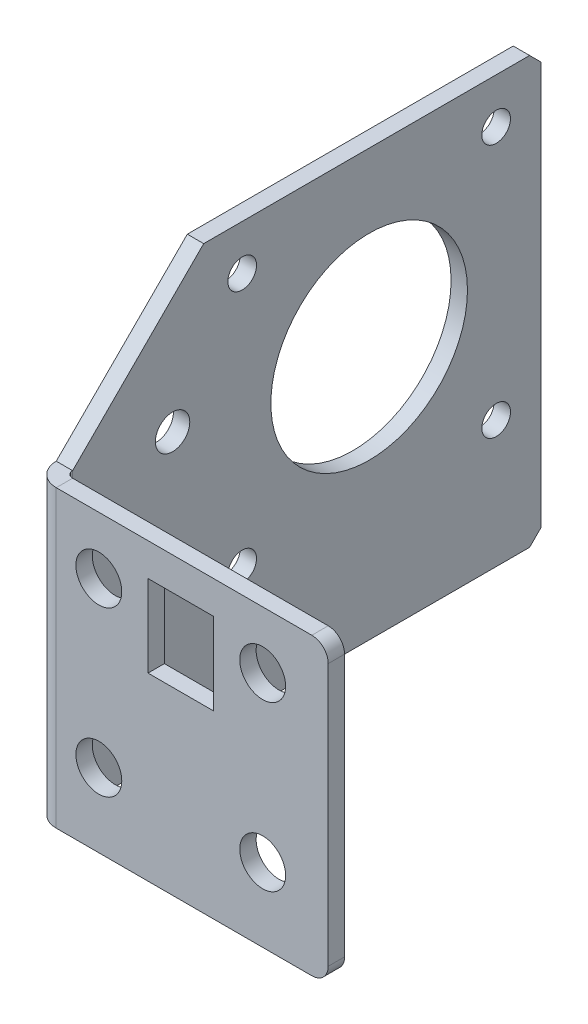
from build123d import *

# Parameters (mm, degrees)
BASE_FLANGE1_DEPTH = 52
CUT_EXTRUDE1_DEPTH = 88.177978871
FILLET1_R          = 2
SKETCH7_R          = 12
SKETCH7_R_2        = 1.75
CUT_EXTRUDE2_DEPTH = 10
SKETCH8_R          = 2.8
CUT_EXTRUDE3_DEPTH = 2
SKETCH9_W          = 8
SKETCH9_H          = 10
CUT_EXTRUDE4_DEPTH = 10
SKETCH10_R         = 2.1
CUT_EXTRUDE5_DEPTH = 10


# Sheet-metal steps are written as plain solids
with BuildPart() as part:
    # Sketch1 → Base-Flange1 (new body)
    with BuildSketch(Plane(origin=(0, 0, 0), x_dir=(1, 0, 0), z_dir=(0, 1, 0))):
        with BuildLine():
            Line((36, 0), (2.8, 0))
            ThreePointArc((2.8, 0), (0.820101013, 0.820101013), (0, 2.8))
            Line((0, 2.8), (0, 60))
            Line((0, 60), (2, 60))
            Line((2, 60), (2, 2.8))
            ThreePointArc((2, 2.8), (2.234314575, 2.234314575), (2.8, 2))
            Line((2.8, 2), (36, 2))
            Line((36, 2), (36, 0))
        make_face()
    extrude(amount=BASE_FLANGE1_DEPTH)

    # Sketch6 → Cut-Extrude1 (cut, through all)
    with BuildSketch(Plane.ZY):
        Polygon((-18.8, 52), (-2.8, 36), (0, 36), (0, 52), align=None)
        Polygon((-60, 52), (-58.585786438, 52), (-60, 50.585786438), align=None)
        Polygon((-60, 1.414213562), (-60, 0), (-58.585786438, 0), align=None)
    extrude(amount=-CUT_EXTRUDE1_DEPTH, mode=Mode.SUBTRACT)

    # Fillet1
    fillet1_edges = [part.edges().sort_by_distance(p)[0] for p in [
        (36, 36, -1),
        (36, 0, -1),
    ]]
    fillet(fillet1_edges, radius=FILLET1_R)

    # Sketch7 → Cut-Extrude2 (cut)
    with BuildSketch(Plane(origin=(2, 0, 0), x_dir=(0, 0, -1), z_dir=(1, 0, 0))):
        with Locations((39, 31)):
            Circle(SKETCH7_R)
        with Locations((54.5, 46.5)):
            Circle(SKETCH7_R_2)
        with Locations(Location((23.5, 46.5, 0), (0, 0, 180))):
            Circle(SKETCH7_R_2)
        with Locations(Location((54.5, 15.5, 0), (0, 0, 180))):
            Circle(SKETCH7_R_2)
        with Locations((23.5, 15.5)):
            Circle(SKETCH7_R_2)
    extrude(amount=-CUT_EXTRUDE2_DEPTH, mode=Mode.SUBTRACT)

    # Sketch8 → Cut-Extrude3 (cut)
    with BuildSketch(Plane.XY):
        with Locations((28, 29)):
            Circle(SKETCH8_R)
        with Locations(Location((28, 9, 0), (0, 0, 180))):
            Circle(SKETCH8_R)
        with Locations((8, 9)):
            Circle(SKETCH8_R)
        with Locations(Location((8, 29, 0), (0, 0, 180))):
            Circle(SKETCH8_R)
    extrude(amount=-CUT_EXTRUDE3_DEPTH, mode=Mode.SUBTRACT)

    # Sketch9 → Cut-Extrude4 (cut)
    with BuildSketch(Plane(origin=(0, 0, -2), x_dir=(-1, 0, 0), z_dir=(0, 0, -1))):
        with Locations((-18, 27)):
            Rectangle(SKETCH9_W, SKETCH9_H)
    extrude(amount=-CUT_EXTRUDE4_DEPTH, mode=Mode.SUBTRACT)

    # Sketch10 → Cut-Extrude5 (cut)
    with BuildSketch(Plane(origin=(2, 0, 0), x_dir=(0, 0, -1), z_dir=(1, 0, 0))):
        with Locations((15, 34)):
            Circle(SKETCH10_R)
    extrude(amount=-CUT_EXTRUDE5_DEPTH, mode=Mode.SUBTRACT)


solid = part.part
